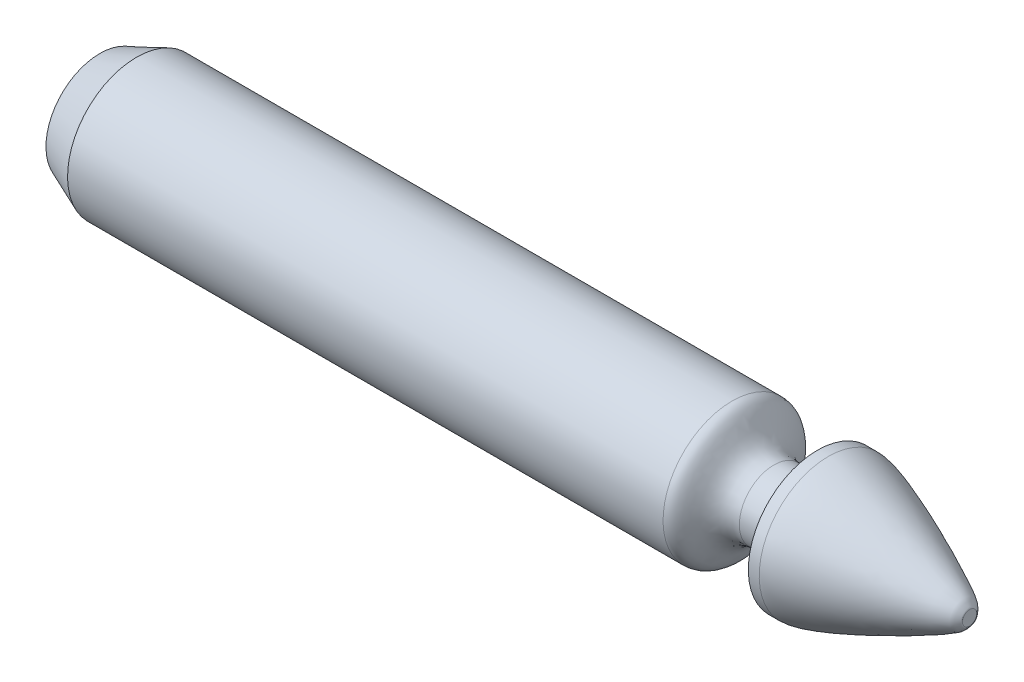
from build123d import *


with BuildPart() as part:
    # body_sketch → body (revolve)
    with BuildSketch(Plane.XY):
        with BuildLine():
            Line((-16.73571407, 3.175), (-10.921788615, 3.175))
            add(Edge.make_bspline(
                [(-10.921788615, 3.175), (-10.165447426, 3.175), (-10.250040485, 1.5875), (-9, 1.5875)],
                knots=[0, 0, 0, 0, 1, 1, 1, 1], degree=3))
            Line((-9, 1.5875), (-7, 1.5875))
            Line((-7, 1.5875), (-7, 3.175))
            Line((-7, 3.175), (-6.5, 3.175))
            add(Edge.make_bspline(
                [(-6.5, 3.175), (-5.484084378, 3.175), (-0.454332814, 0.896409492), (-0.05462572, 0.424300736), (0, 0.377250903), (0, 0.327812847)],
                knots=[0, 0, 0, 0, 0.586137631, 0.686137631, 1, 1, 1, 1], degree=3))
            Line((0, 0.327812847), (0, 0))
            Line((0, 0), (-40, 0))
            Line((-40, 0), (-40, 2.477839401))
            Line((-40, 2.477839401), (-38.309951565, 3.175))
            Line((-38.309951565, 3.175), (-20.811079947, 3.175))
            add(Edge.make_bspline(
                [(-20.811079947, 3.175), (-19.383200887, 3.175), (-18.073641119, 3.175), (-16.73571407, 3.175)],
                knots=[0, 0, 0, 0, 1, 1, 1, 1], degree=3))
        make_face()
    revolve(axis=Axis((0, 0, 0), (-1, 0, 0)))


solid = part.part
